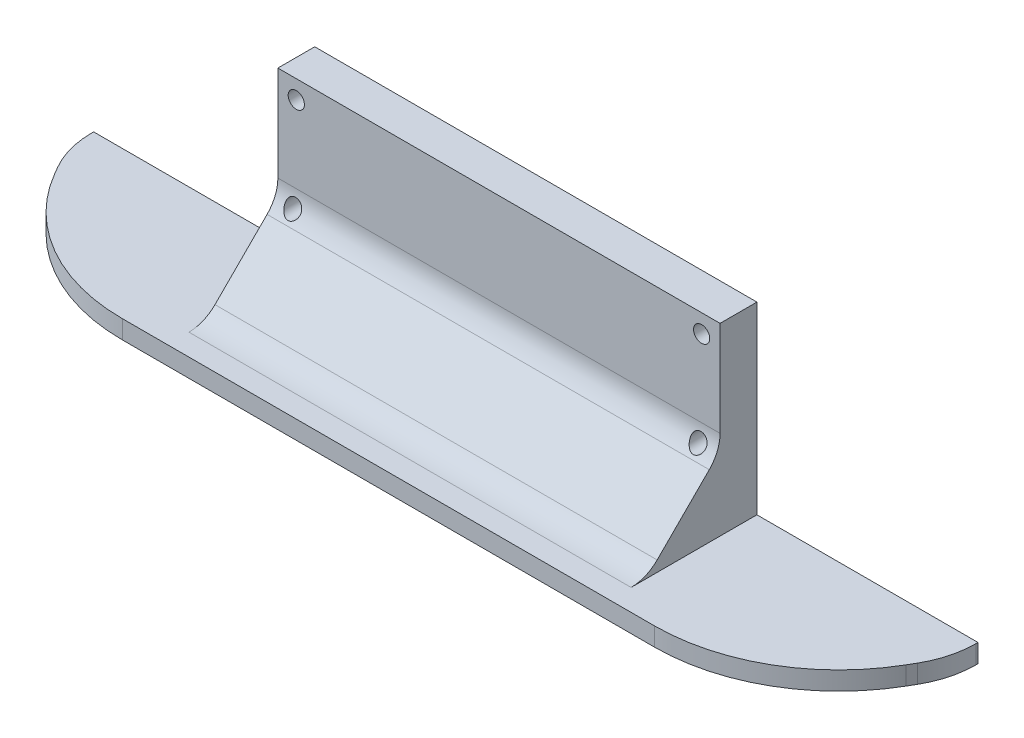
from build123d import *
from OCP.BRepFilletAPI import BRepFilletAPI_MakeChamfer

# Parameters (mm, degrees)
SKETCH_1_W               = 240
SKETCH_1_H               = 40
EXTRUDE_1_DEPTH          = 5
SKETCH_2_W               = 120
SKETCH_2_H               = 10
EXTRUDE_2_DEPTH          = 50
CHAMFER_1_SIZE           = 20
FILLET_4_R               = 10
CUT_EXTRUDE_1_DEPTH      = 136.369863707
CUT_EXTRUDE_1_DEPTH_BACK = 136.369863707
SKETCH_4_R               = 2.2
CHAMFER_2_SIZE           = 25
CHAMFER_3_SIZE           = 15
CHAMFER_3_SIZE2          = 7.764571353
FILLET_6_R               = 25
FILLET_7_R               = 50
FILLET_8_R               = 50


with BuildPart() as part:
    # 草图1 → 凸台-拉伸1 (new body)
    with BuildSketch(Plane(origin=(0, 0, 0), x_dir=(1, 0, 0), z_dir=(0, 1, 0))):
        Rectangle(SKETCH_1_W, SKETCH_1_H)
    extrude(amount=EXTRUDE_1_DEPTH)

    # 草图2 → 凸台-拉伸2 (add)
    with BuildSketch(Plane(origin=(0, 5, 0), x_dir=(1, 0, 0), z_dir=(0, 1, 0))):
        with Locations((0, 15)):
            Rectangle(SKETCH_2_W, SKETCH_2_H)
    extrude(amount=EXTRUDE_2_DEPTH)

    # 倒角1
    chamfer_1_edges = [part.edges().sort_by_distance(p)[0] for p in [
        (0, 5, -10),
    ]]
    chamfer(chamfer_1_edges, length=CHAMFER_1_SIZE)

    # 圆角4
    fillet_4_edges = [part.edges().sort_by_distance(p)[0] for p in [
        (0, 25, -10),
        (0, 5, 10),
    ]]
    fillet(fillet_4_edges, radius=FILLET_4_R)

    # 草图4 → 切除-拉伸1 (cut, two sides: drawn at the far end of the back side and taken through both)
    with BuildSketch(Plane.XY.offset(-10).offset(-CUT_EXTRUDE_1_DEPTH_BACK)):
        with Locations((-55, 50)):
            Circle(SKETCH_4_R)
        with Locations((55, 50)):
            Circle(SKETCH_4_R)
        with Locations((-55, 25)):
            Circle(SKETCH_4_R)
        with Locations((55, 25)):
            Circle(SKETCH_4_R)
    extrude(amount=CUT_EXTRUDE_1_DEPTH + CUT_EXTRUDE_1_DEPTH_BACK, mode=Mode.SUBTRACT)

    # 倒角2
    chamfer_2_edges = [part.edges().sort_by_distance(p)[0] for p in [
        (120, 2.5, 20),
        (-120, 2.5, 20),
    ]]
    chamfer(chamfer_2_edges, length=CHAMFER_2_SIZE)

    # 倒角3: one chamfer whose edges measure the first distance from different faces: ONE call of the kernel's chamfer builder (chamfer() names one face for all edges)
    chamfer_3_edges_1 = [part.edges().sort_by_distance(p)[0] for p in [
        (120, 2.5, -5),
    ]]
    chamfer_3_side_1 = [part.faces().sort_by_distance(p)[0] for p in [
        (107.5, 2.5, 7.5),
    ]]
    chamfer_3_edges_2 = [part.edges().sort_by_distance(p)[0] for p in [
        (-120, 2.5, -5),
    ]]
    chamfer_3_side_2 = [part.faces().sort_by_distance(p)[0] for p in [
        (-107.5, 2.5, 7.5),
    ]]
    chamfer_3 = BRepFilletAPI_MakeChamfer(part.part.solid().wrapped)
    for e in chamfer_3_edges_1:
        chamfer_3.Add(CHAMFER_3_SIZE, CHAMFER_3_SIZE2, e.wrapped, chamfer_3_side_1[0].wrapped)  # the first distance lies on this face
    for e in chamfer_3_edges_2:
        chamfer_3.Add(CHAMFER_3_SIZE, CHAMFER_3_SIZE2, e.wrapped, chamfer_3_side_2[0].wrapped)  # the first distance lies on this face
    add(Compound.cast(chamfer_3.Shape()), mode=Mode.REPLACE)

    # 圆角6
    fillet_6_edges = [part.edges().sort_by_distance(p)[0] for p in [
        (-120, 2.5, -12.764571353),
        (120, 2.5, -12.764571353),
    ]]
    fillet(fillet_6_edges, radius=FILLET_6_R)

    # 圆角7
    # the kernel refuses this fillet: 50 mm, written as the material it takes off along each edge
    with BuildSketch(Plane(origin=(95, -51.772199057, 20), x_dir=(-1, 0, 0), z_dir=(0, 1, 0))) as fillet_7_piece_1:
        with BuildLine():
            CenterArc((20.708879623, -50), FILLET_7_R, 90, 44.591350674)
            Line((-14.393398282, -14.393398282), (-15.09544384, -13.681266248))
            Line((-15.09544384, -13.681266248), (-0.707106781, 0.707106781))
            Line((-0.707106781, 0.707106781), (0, 1))
            Line((0, 1), (20.708879623, 1))
            Line((20.708879623, 1), (20.708879623, 0))
        make_face()
    extrude(amount=108.544398113, mode=Mode.SUBTRACT)
    with BuildSketch(Plane(origin=(-95, -51.772199057, 20), x_dir=(-0.7071067811865476, 0, -0.7071067811865476), z_dir=(0, 1, 0))) as fillet_7_piece_2:
        with BuildLine():
            CenterArc((20.711949847, -49.998728271), FILLET_7_R, 90.408649326, 44.591350674)
            Line((-14.643389212, -14.643389212), (-15.350495993, -13.936282431))
            Line((-15.350495993, -13.936282431), (-0.707106781, 0.707106781))
            Line((-0.707106781, 0.707106781), (0, 1))
            Line((0, 1), (20.348206844, 0.999974565))
            Line((20.348206844, 0.999974565), (20.355339059, 0))
        make_face()
    extrude(amount=108.544398113, mode=Mode.SUBTRACT)

    # 圆角8
    # the kernel refuses this fillet: 50 mm, written as the material it takes off along each edge
    with BuildSketch(Plane(origin=(109.393398282, -99.666312896, 5.606601718), x_dir=(0.49999999999999956, 0, -0.8660254037844389), z_dir=(0, 1, 0))) as fillet_8_piece_1:
        with BuildLine():
            CenterArc((12.247448714, 50), FILLET_8_R, 210, 60)
            Line((-31.053821475, 25), (-35.383948494, 22.5))
            ThreePointArc((-35.383948494, 22.5), (-34.346314531, 20.702765255), (-1.328508268, -4.820276526))
            Line((-1.328508268, -4.820276526), (0, -5))
            Line((0, -5), (12.247448714, -5))
            Line((12.247448714, -5), (12.247448714, 0))
        make_face()
    extrude(amount=204.332625793, mode=Mode.SUBTRACT)
    with BuildSketch(Plane(origin=(-109.393398282, -99.666312896, 5.606601718), x_dir=(0.9325504463801257, 0, 0.3610396999724933), z_dir=(0, 1, 0))) as fillet_8_piece_2:
        with BuildLine():
            CenterArc((21.81454016, 46.627522319), FILLET_8_R, 231.16406129, 60)
            Line((-9.540086185, 7.680283562), (-12.675548819, 3.785559686))
            Line((-12.675548819, 3.785559686), (-3.135462634, -3.894723876))
            Line((-3.135462634, -3.894723876), (-1.987924813, -4.587826821))
            ThreePointArc((-1.987924813, -4.587826821), (39.736431626, -5.412006342), (41.671723658, -4.662752232))
            Line((41.671723658, -4.662752232), (39.866525159, 0))
        make_face()
    extrude(amount=204.332625793, mode=Mode.SUBTRACT)


solid = part.part
